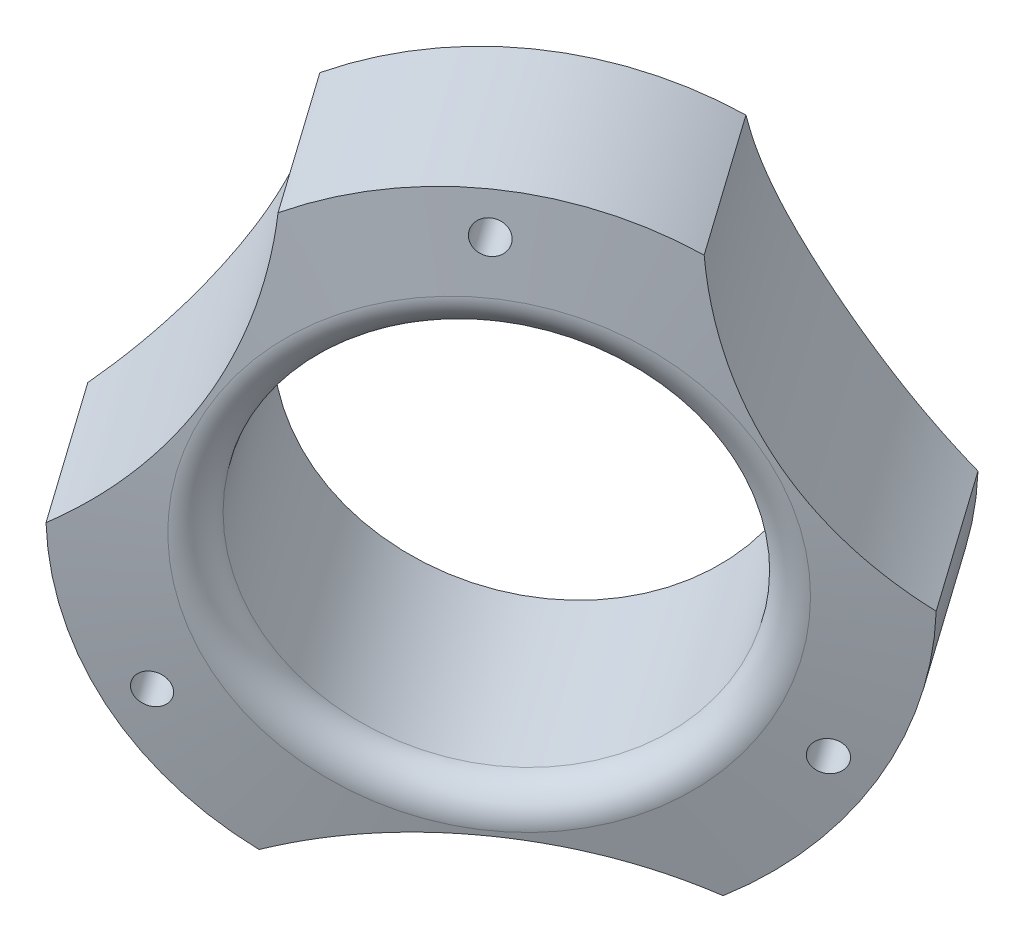
from build123d import *

# Parameters (mm, degrees)
SKETCH_2_R          = 1
SKETCH_2_R_2        = 25
SKETCH_2_R_3        = 12.5
CUT_EXTRUDE_1_DEPTH = 24
FILLET_1_R          = 2


with BuildPart() as part:
    # 草图1 → 旋转1 (revolve)
    with BuildSketch(Plane(origin=(0, 0, 0), x_dir=(1, 0, 0), z_dir=(0, 1, 0))):
        Polygon((16.733350813, 28.983013789), (11.038988511, 19.120088966), (17.433204862, 10.06506552), (26.42596579, 15.257038463), align=None)
    revolve(axis=Axis((35.122395357, 0, -20.277924414), (-0.576829805989874, 0, -0.8168643552767402)))

    # 草图2 → 切除-拉伸1 (cut)
    with BuildSketch(Plane(origin=(1.603790962, 0, 2.271171941), x_dir=(0.8168643552767402, 0, -0.576829805989874), z_dir=(0.576829805989874, 0, 0.8168643552767403))):
        with Locations((40.387144045, 17.840750604)):
            Circle(SKETCH_2_R)
        with Locations((5.746127894, 20)):
            Circle(SKETCH_2_R_2)
        with Locations((75.028160197, 20)):
            Circle(SKETCH_2_R_2)
        with Locations((55.837687291, -8.920375302)):
            Circle(SKETCH_2_R)
        with Locations((40.387144045, -40)):
            Circle(SKETCH_2_R_2)
        with Locations((24.9366008, -8.920375302)):
            Circle(SKETCH_2_R)
        with Locations((40.387144045, 0)):
            Circle(SKETCH_2_R_3)
    extrude(amount=-CUT_EXTRUDE_1_DEPTH, mode=Mode.SUBTRACT)

    # 圆角1
    fillet_1_edges = [part.edges().sort_by_distance(p)[0] for p in [
        (34.46266284, 12.5, -21.21218955),
    ]]
    fillet(fillet_1_edges, radius=FILLET_1_R)


solid = part.part
